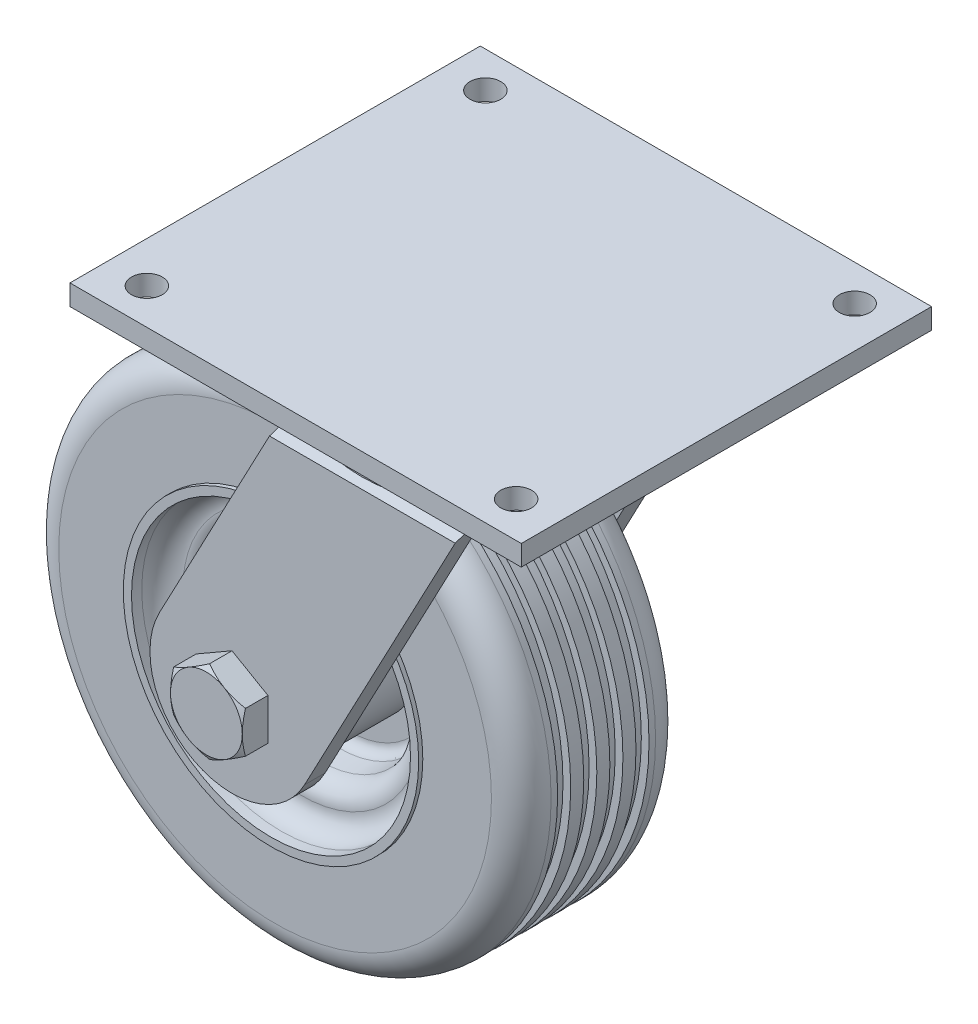
from build123d import *

# Parameters (mm, degrees)
SKETCH1_W               = 139.7
SKETCH1_H               = 6.35
BOSS_EXTRUDE1_DEPTH     = 63.5
SKETCH3_R               = 4.7625
F_3_HOLES_DEPTH         = 95.612869104
SKETCH7_W               = 149.389080988
SKETCH7_H               = 77.47
BOSS_EXTRUDE2_DEPTH     = 160.1724
CUT_EXTRUDE1_START      = -77.47
CUT_EXTRUDE1_DEPTH      = 77.47
CUT_EXTRUDE3_DEPTH      = 199.527313847
CUT_EXTRUDE3_DEPTH_BACK = 199.527313847
SKETCH9_OUTSIDE_W       = 188.164
SKETCH9_OUTSIDE_H       = 248.489
BOSS_EXTRUDE3_DEPTH     = 7.9375
SKETCH11_OUTSIDE_W      = 1116.186
SKETCH11_OUTSIDE_H      = 1113.011
SKETCH11_OUTSIDE_R      = 11.1125
CUT_EXTRUDE4_DEPTH      = 249.566003143
CUT_EXTRUDE4_DRAFT      = -60
SKETCH12_R              = 10.795
BOSS_EXTRUDE4_DEPTH     = 64.77


# Read off the part's stored shape, not the designer's step: Cut-Extrude1
with BuildPart() as part:
    # Sketch1 → Boss-Extrude1 (new, symmetric)
    with BuildSketch(Plane.XY):
        with Locations((0, -3.175)):
            Rectangle(SKETCH1_W, SKETCH1_H)
    extrude(amount=BOSS_EXTRUDE1_DEPTH, both=True)

    # Sketch3 → 3-holes (cut, through all)
    with BuildSketch(Plane(origin=(0, 0, 0), x_dir=(1, 0, 0), z_dir=(0, 1, 0))):
        with Locations(Location((-57.15, 52.3875, 0), (0, 0, 270))):
            Circle(SKETCH3_R)
        with Locations(Location((57.15, 52.3875, 0), (0, 0, 90))):
            Circle(SKETCH3_R)
        with Locations(Location((57.15, -52.3875, 0), (0, 0, 270))):
            Circle(SKETCH3_R)
        with Locations(Location((-57.15, -52.3875, 0), (0, 0, 90))):
            Circle(SKETCH3_R)
    extrude(amount=-F_3_HOLES_DEPTH, mode=Mode.SUBTRACT)


with BuildPart() as body_2:
    # Sketch4 → Revolve1 (revolve)
    with BuildSketch(Plane.XY, mode=Mode.PRIVATE) as revolve1_sk:
        Polygon((0, -27.1526), (43.18, -27.1526), (43.18, -16.0401), (40.64, -16.0401), (40.64, -13.5001), (44.45, -13.5001), (44.45, -6.35), (0, -6.35), align=None)
    revolve(revolve1_sk.sketch.rotate(Axis((0, -6.35, 0), (0, -1, 0)), 180), axis=Axis((0, -6.35, 0), (0, -1, 0)))


with BuildPart() as body_3:
    # Sketch6 → Revolve2 (revolve)
    with BuildSketch(Plane(origin=(-44.45, 0, 0), x_dir=(0, 0, -1), z_dir=(1, 0, 0)), mode=Mode.PRIVATE) as revolve2_sk:
        with BuildLine():
            Line((-25.4, -65.405), (-25.4, -44.161363636))
            ThreePointArc((-25.4, -44.161363636), (-22.694731724, -37.630268276), (-16.163636364, -34.925))
            Line((-16.163636364, -34.925), (-14.143181818, -34.925))
            Line((-14.143181818, -34.925), (-14.143181818, -37.30625))
            Line((-14.143181818, -37.30625), (-10.102272727, -37.30625))
            Line((-10.102272727, -37.30625), (-10.102272727, -34.925))
            Line((-10.102272727, -34.925), (-6.061363636, -34.925))
            Line((-6.061363636, -34.925), (-6.061363636, -37.30625))
            Line((-6.061363636, -37.30625), (-2.020454545, -37.30625))
            Line((-2.020454545, -37.30625), (-2.020454545, -34.925))
            Line((-2.020454545, -34.925), (2.020454545, -34.925))
            Line((2.020454545, -34.925), (2.020454545, -37.30625))
            Line((2.020454545, -37.30625), (6.061363636, -37.30625))
            Line((6.061363636, -37.30625), (6.061363636, -34.925))
            Line((6.061363636, -34.925), (10.102272727, -34.925))
            Line((10.102272727, -34.925), (10.102272727, -37.30625))
            Line((10.102272727, -37.30625), (14.143181818, -37.30625))
            Line((14.143181818, -37.30625), (14.143181818, -34.925))
            Line((14.143181818, -34.925), (16.163636364, -34.925))
            ThreePointArc((16.163636364, -34.925), (22.694731724, -37.630268276), (25.4, -44.161363636))
            Line((25.4, -44.161363636), (25.4, -65.405))
            Line((25.4, -65.405), (26.67, -65.405))
            Line((26.67, -65.405), (26.67, -67.945))
            Line((26.67, -67.945), (23.495, -67.945))
            ThreePointArc((23.495, -67.945), (19.004871939, -69.804871939), (17.145, -74.295))
            ThreePointArc((17.145, -74.295), (15.476711089, -78.584997818), (11.348438966, -80.620836333))
            Line((11.348438966, -80.620836333), (5.438280517, -81.137908197))
            ThreePointArc((5.438280517, -81.137908197), (3.374144456, -82.155827454), (2.54, -84.300826363))
            Line((2.54, -84.300826363), (2.54, -90.4875))
            Line((2.54, -90.4875), (26.67, -90.4875))
            Line((26.67, -90.4875), (29.845, -90.4875))
            Line((29.845, -90.4875), (29.845, -111.125))
            Line((29.845, -111.125), (-29.845, -111.125))
            Line((-29.845, -111.125), (-29.845, -90.4875))
            Line((-29.845, -90.4875), (-26.67, -90.4875))
            Line((-26.67, -90.4875), (-2.54, -90.4875))
            Line((-2.54, -90.4875), (-2.54, -84.300826363))
            ThreePointArc((-2.54, -84.300826363), (-3.374144456, -82.155827454), (-5.438280517, -81.137908197))
            Line((-5.438280517, -81.137908197), (-11.348438966, -80.620836333))
            ThreePointArc((-11.348438966, -80.620836333), (-15.476711089, -78.584997818), (-17.145, -74.295))
            ThreePointArc((-17.145, -74.295), (-19.004871939, -69.804871939), (-23.495, -67.945))
            Line((-23.495, -67.945), (-26.67, -67.945))
            Line((-26.67, -67.945), (-26.67, -65.405))
            Line((-26.67, -65.405), (-25.4, -65.405))
        make_face()
    revolve(revolve2_sk.sketch.rotate(Axis((-44.45, -111.125, 111.145303652), (0, 0, -1)), 90), axis=Axis((-44.45, -111.125, 111.145303652), (0, 0, -1)))


with BuildPart() as body_4:
    # Sketch7 → Boss-Extrude2 (new body)
    with BuildSketch(Plane.XZ.offset(27.1526)):
        with Locations((-45.955459506, 0)):
            Rectangle(SKETCH7_W, SKETCH7_H)
    extrude(amount=BOSS_EXTRUDE2_DEPTH)

    # Cut-Extrude1 outline → Cut-Extrude1 (cut)
    with BuildSketch(Plane.XY.offset(38.735).offset(CUT_EXTRUDE1_START)):
        with BuildLine():
            Line((28.739080988, -27.1526), (-22.001126277, -123.008100125))
            ThreePointArc((-22.001126277, -123.008100125), (-56.333100125, -133.573873723), (-66.898873723, -99.241899875))
            Line((-66.898873723, -99.241899875), (-28.739080988, -27.1526))
            Line((-28.739080988, -27.1526), (-120.65, -27.1526))
            Line((-120.65, -27.1526), (-120.65, -187.325))
            Line((-120.65, -187.325), (28.739080988, -187.325))
            Line((28.739080988, -187.325), (28.739080988, -27.1526))
        make_face()
    extrude(amount=CUT_EXTRUDE1_DEPTH, mode=Mode.SUBTRACT)

    # Sketch9 outside → Cut-Extrude3 (cut, two sides: drawn at the far end of the back side and taken through both)
    with BuildSketch(Plane(origin=(0, -144.306693689, 0), x_dir=(0, 0, -1), z_dir=(-1, 0, 0)).offset(-CUT_EXTRUDE3_DEPTH_BACK)):
        with Locations((0, -50.6445)):
            Rectangle(SKETCH9_OUTSIDE_W, SKETCH9_OUTSIDE_H)
        Polygon((38.735, 43.018306311), (38.735, -109.381693689), (32.226970444, -117.154093689), (25.876970444, -117.154093689), (32.385, -109.381693689), (32.385, 43.018306311), align=None, mode=Mode.SUBTRACT)
        Polygon((-25.876970444, -117.154093689), (-32.226970444, -117.154093689), (-38.735, -109.381693689), (-38.735, 43.018306311), (-32.385, 43.018306311), (-32.385, -109.381693689), align=None, mode=Mode.SUBTRACT)
    extrude(amount=CUT_EXTRUDE3_DEPTH + CUT_EXTRUDE3_DEPTH_BACK, mode=Mode.SUBTRACT)


with BuildPart() as cut_extrude3_piece_1:
    # of the separate pieces the step leaves, piece 1, a body of its own (cut_extrude3_pieces)
    add(body_4.part.solids().sort_by_distance((24.624834164, -34.925, 38.735))[0])



with BuildPart() as cut_extrude3_piece_2:
    # of the separate pieces the step leaves, piece 2, a body of its own (cut_extrude3_pieces)
    add(body_4.part.solids().sort_by_distance((28.739080988, -27.1526, -32.226970444))[0])


with BuildPart() as body_6:
    # Sketch10 → Boss-Extrude3 (new body)
    with BuildSketch(Plane.XY.offset(38.735)):
        Polygon((-44.45, -98.293390267), (-55.5625, -104.709195134), (-55.5625, -117.540804866), (-44.45, -123.956609733), (-33.3375, -117.540804866), (-33.3375, -104.709195134), align=None)
    extrude(amount=BOSS_EXTRUDE3_DEPTH)


with BuildPart() as cut_extrude4_tool:
    # Sketch11 outside → Cut-Extrude4 (with draft: the straight prism first)
    with BuildSketch(Plane.XY.offset(46.6725)):
        with Locations((-25.4, -93.6625)):
            Rectangle(SKETCH11_OUTSIDE_W, SKETCH11_OUTSIDE_H)
        with Locations((-44.45, -111.125)):
            Circle(SKETCH11_OUTSIDE_R, mode=Mode.SUBTRACT)
    extrude(amount=-CUT_EXTRUDE4_DEPTH)
    # Cut-Extrude4: the draft: its side faces are tilted about the plane it starts from
    cut_extrude4_sides = [cut_extrude4_tool.faces().sort_by_distance(p)[0] for p in [
        (-25.4, -650.168, -78.110501572),
        (532.693, -93.6625, -78.110501572),
        (-25.4, 462.843, -78.110501572),
        (-583.493, -93.6625, -78.110501572),
        (-55.5625, -111.125, -78.110501572),
    ]]
    draft(cut_extrude4_sides, Plane.XY.offset(46.6725), CUT_EXTRUDE4_DRAFT)


with BuildPart() as body_6_1:
    add(body_6.part)

    # Cut-Extrude4: cut by cut_extrude4_tool
    add(cut_extrude4_tool.part, mode=Mode.SUBTRACT)


with BuildPart() as body_7:
    # Mirror1: mirrored copy
    add(body_6_1.part.mirror(Plane.XY))


with BuildPart() as cut_extrude3_piece_1_1:
    add(cut_extrude3_piece_1.part)

    add(cut_extrude3_piece_2.part)  # Boss-Extrude4 merges Cut-Extrude3 piece 2
    # Sketch12 → Boss-Extrude4 (add)
    with BuildSketch(Plane.XY.offset(-32.385)):
        with Locations(Location((-44.45, -111.125, 0), (0, 0, 180))):
            Circle(SKETCH12_R)
    extrude(amount=BOSS_EXTRUDE4_DEPTH)

    # Combine1: union body 7, body 6, body 2, part
    add(body_7.part)
    add(body_6_1.part)
    add(body_2.part)
    add(part.part)


solid = Compound([body_3.part, cut_extrude3_piece_1_1.part])
